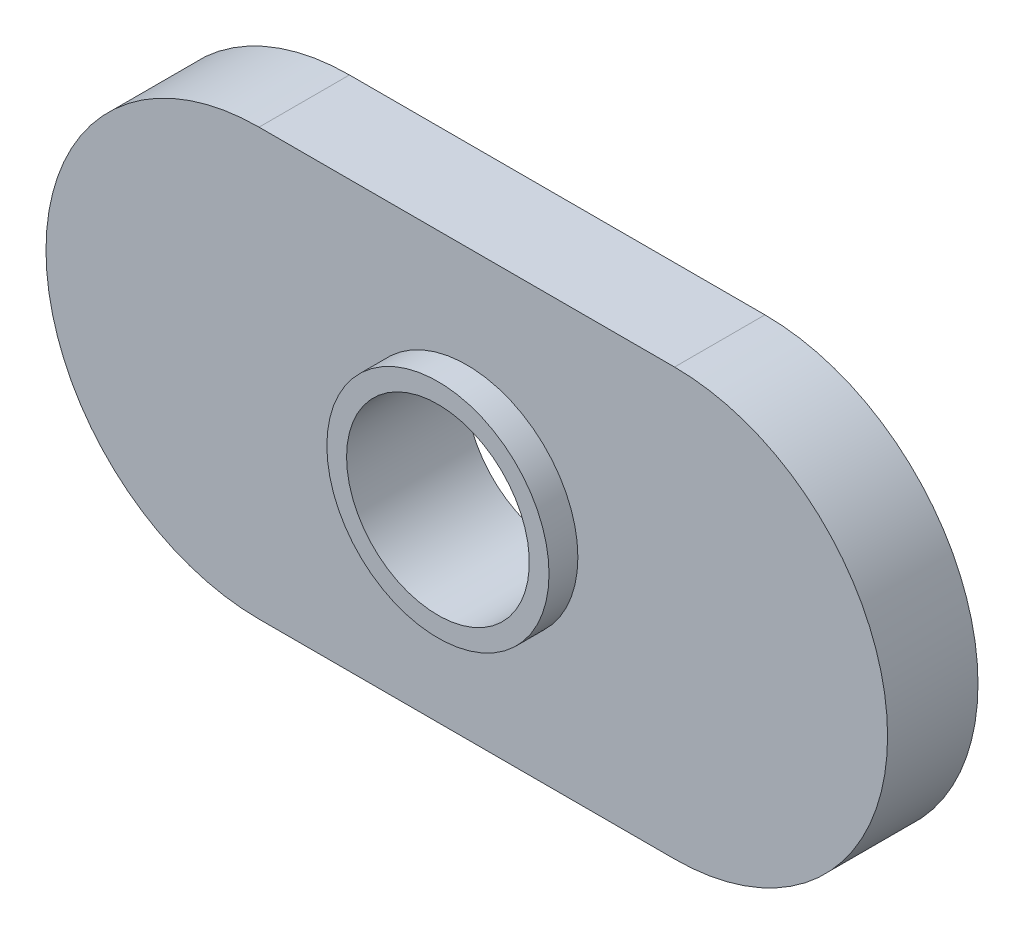
from build123d import *

# Parameters (mm, degrees)
EXTRUDE1_DEPTH     = 2.3876
SKETCH4_R          = 2.9337
EXTRUDE3_DEPTH     = 0.762
SKETCH6_R          = 2.413
CUT_EXTRUDE1_DEPTH = 184.494973074


with BuildPart() as part:
    # Sketch1 → Extrude1 (new body)
    with BuildSketch(Plane.XY):
        with BuildLine():
            Line((111.27866266, 131.559165896), (122.25146266, 131.559165896))
            ThreePointArc((122.25146266, 131.559165896), (127.87756266, 125.933065896), (122.25146266, 120.306965896))
            Line((122.25146266, 120.306965896), (111.27866266, 120.306965896))
            ThreePointArc((111.27866266, 120.306965896), (105.65256266, 125.933065896), (111.27866266, 131.559165896))
        make_face()
    extrude(amount=EXTRUDE1_DEPTH)

    # Sketch4 → Extrude3 (add)
    with BuildSketch(Plane.XY.offset(2.3876)):
        with Locations((116.76506266, 125.933065896)):
            Circle(SKETCH4_R)
    extrude(amount=EXTRUDE3_DEPTH)

    # Sketch6 → Cut-Extrude1 (cut, through all)
    with BuildSketch(Plane(origin=(0, 0, 0), x_dir=(-1, 0, 0), z_dir=(0, 0, -1))):
        with Locations((-116.76506266, 125.933065896)):
            Circle(SKETCH6_R)
    extrude(amount=-CUT_EXTRUDE1_DEPTH, mode=Mode.SUBTRACT)


solid = part.part
